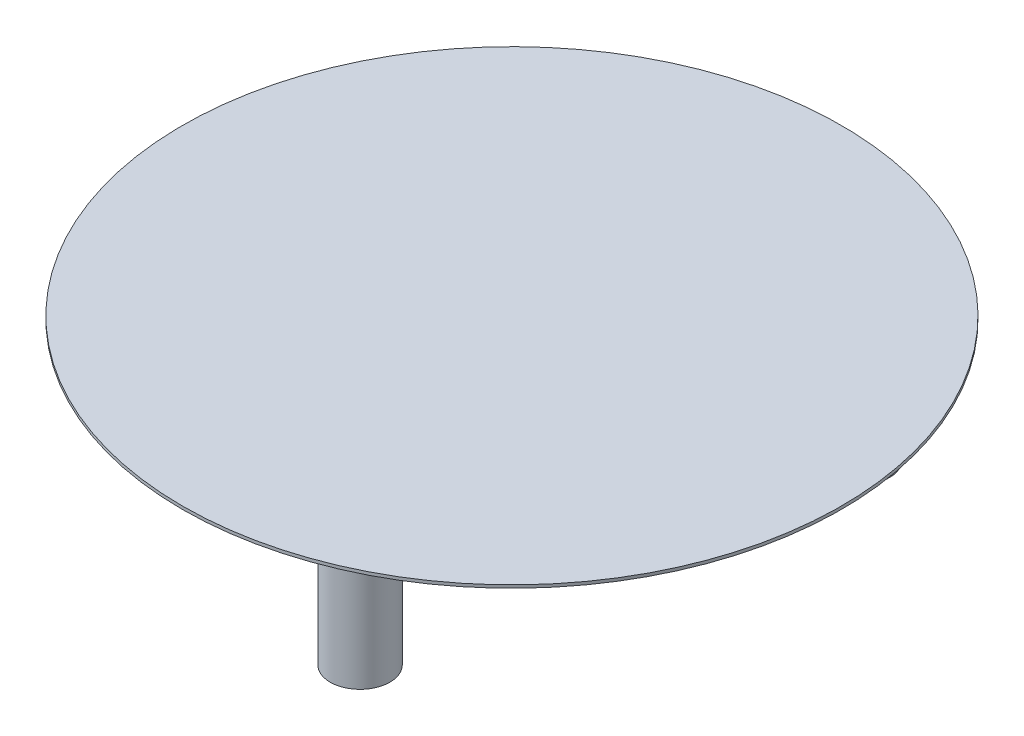
from build123d import *

# Parameters (mm, degrees)
SKETCH1_R           = 43.815
BOSS_EXTRUDE1_DEPTH = 0.396875
SKETCH2_R           = 3.96875
BOSS_EXTRUDE2_DEPTH = 19.05


with BuildPart() as part:
    # Sketch1 → Boss-Extrude1 (new body)
    with BuildSketch(Plane(origin=(0, 0, 0), x_dir=(1, 0, 0), z_dir=(0, 1, 0))):
        Circle(SKETCH1_R)
    extrude(amount=BOSS_EXTRUDE1_DEPTH)

    # Sketch2 → Boss-Extrude2 (add)
    with BuildSketch(Plane.XZ):
        with Locations((20.32, -25.908)):
            Circle(SKETCH2_R)
        with Locations((-25.908, -19.939)):
            Circle(SKETCH2_R)
        with Locations((10.668, 30.861)):
            Circle(SKETCH2_R)
    extrude(amount=BOSS_EXTRUDE2_DEPTH)


solid = part.part
